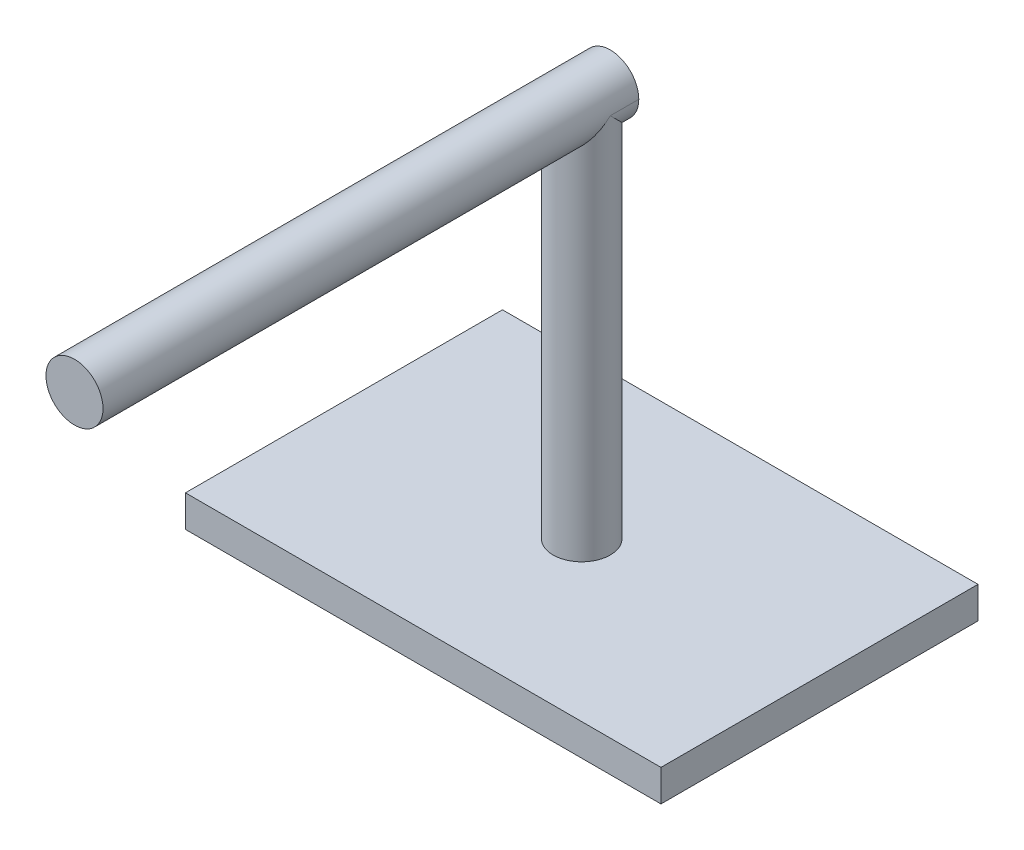
from build123d import *
from build123d.topology import SkipClean

# Parameters (mm, degrees)
SKETCH1_W                = 150
SKETCH1_H                = 100
BOSS_EXTRUDE1_DEPTH      = 10
SKETCH6_R                = 9
BOSS_EXTRUDE6_DEPTH      = 120
BOSS_EXTRUDE7_DEPTH      = 120
BOSS_EXTRUDE7_DEPTH_BACK = 49
SKETCH7_R                = 9


with BuildPart() as part:
    # Sketch1 → Boss-Extrude1 (new body)
    with BuildSketch(Plane(origin=(0, 0, 0), x_dir=(1, 0, 0), z_dir=(0, 1, 0))):
        Rectangle(SKETCH1_W, SKETCH1_H)
    extrude(amount=BOSS_EXTRUDE1_DEPTH)

    # Sketch6 → Boss-Extrude6 (add)
    with BuildSketch(Plane(origin=(0, 10, 0), x_dir=(1, 0, 0), z_dir=(0, 1, 0))):
        Circle(SKETCH6_R)
    extrude(amount=BOSS_EXTRUDE6_DEPTH)

    # Sketch7 → Boss-Extrude7 (add, two sides: drawn at the far end of the back side and taken through both)
    with SkipClean():  # the faces are left unmerged after this step: merging them gives an invalid solid
        with BuildSketch(Plane.XY.offset(40).offset(-BOSS_EXTRUDE7_DEPTH_BACK)):
            with Locations((0, 130)):
                Circle(SKETCH7_R)
        extrude(amount=BOSS_EXTRUDE7_DEPTH + BOSS_EXTRUDE7_DEPTH_BACK)


solid = part.part
